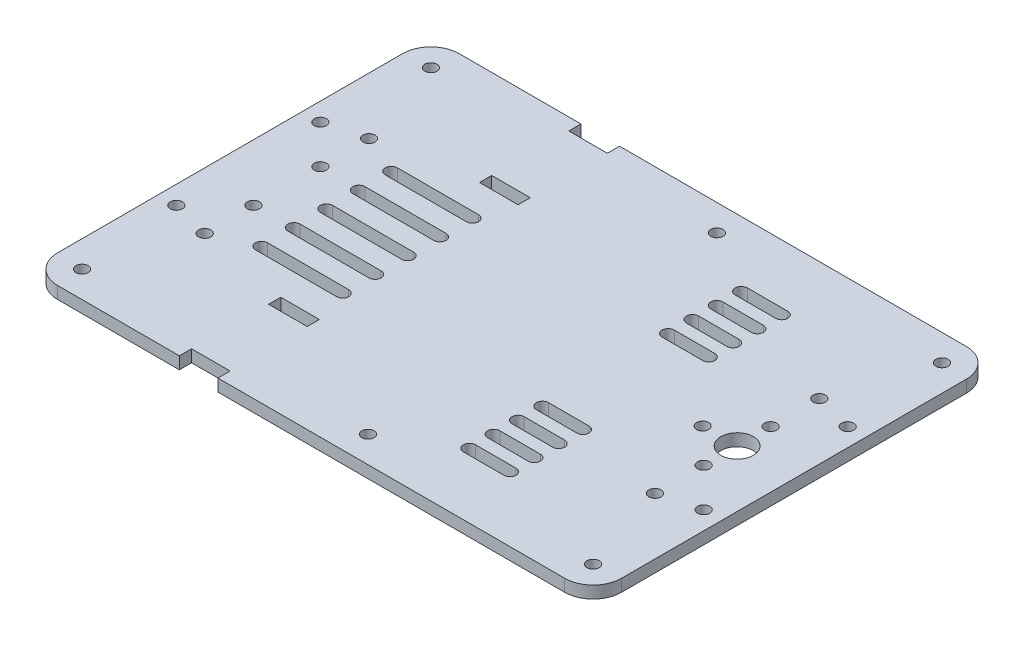
from build123d import *

# Parameters (mm, degrees)
SKETCH1_R           = 1.5
SKETCH1_W           = 9.5
SKETCH1_H           = 3
SKETCH1_R_2         = 4
BOSS_EXTRUDE1_DEPTH = 3


with BuildPart() as part:
    # Sketch1 → Boss-Extrude1 (new body)
    with BuildSketch(Plane(origin=(0, 0, 0), x_dir=(1, 0, 0), z_dir=(0, 1, 0))):
        with BuildLine():
            Line((-23, 46.5), (-32.5, 46.5))
            Line((-32.5, 46.5), (-32.5, 49.5))
            Line((-32.5, 49.5), (-62.5, 49.5))
            ThreePointArc((-62.5, 49.5), (-67.449747468, 47.449747468), (-69.5, 42.5))
            Line((-69.5, 42.5), (-69.5, -42.5))
            ThreePointArc((-69.5, -42.5), (-67.449747468, -47.449747468), (-62.5, -49.5))
            Line((-62.5, -49.5), (-32.5, -49.5))
            Line((-32.5, -49.5), (-32.5, -46.5))
            Line((-32.5, -46.5), (-23, -46.5))
            Line((-23, -46.5), (-23, -49.5))
            Line((-23, -49.5), (62.5, -49.5))
            ThreePointArc((62.5, -49.5), (67.449747468, -47.449747468), (69.5, -42.5))
            Line((69.5, -42.5), (69.5, 42.5))
            ThreePointArc((69.5, 42.5), (67.449747468, 47.449747468), (62.5, 49.5))
            Line((62.5, 49.5), (-23, 49.5))
            Line((-23, 49.5), (-23, 46.5))
        make_face()
        with Locations((-63, -43)):
            Circle(SKETCH1_R, mode=Mode.SUBTRACT)
        with Locations((-27.75, -26)):
            Rectangle(SKETCH1_W, SKETCH1_H, mode=Mode.SUBTRACT)
        with Locations((-55.5, -20.25)):
            Circle(SKETCH1_R, mode=Mode.SUBTRACT)
        with Locations((-65, -17.75)):
            Circle(SKETCH1_R, mode=Mode.SUBTRACT)
        with BuildLine():
            Line((-25.75, -17.5), (-45.75, -17.5))
            ThreePointArc((-45.75, -17.5), (-47.25, -16), (-45.75, -14.5))
            Line((-45.75, -14.5), (-25.75, -14.5))
            ThreePointArc((-25.75, -14.5), (-24.25, -16), (-25.75, -17.5))
        make_face(mode=Mode.SUBTRACT)
        with Locations((-55.5, -8.25)):
            Circle(SKETCH1_R, mode=Mode.SUBTRACT)
        with BuildLine():
            Line((-25.75, -9.5), (-45.75, -9.5))
            ThreePointArc((-45.75, -9.5), (-47.25, -8), (-45.75, -6.5))
            Line((-45.75, -6.5), (-25.75, -6.5))
            ThreePointArc((-25.75, -6.5), (-24.25, -8), (-25.75, -9.5))
        make_face(mode=Mode.SUBTRACT)
        with BuildLine():
            Line((-25.75, -1.5), (-45.75, -1.5))
            ThreePointArc((-45.75, -1.5), (-47.25, 0), (-45.75, 1.5))
            Line((-45.75, 1.5), (-25.75, 1.5))
            ThreePointArc((-25.75, 1.5), (-24.25, 0), (-25.75, -1.5))
        make_face(mode=Mode.SUBTRACT)
        with Locations((7.5, -43)):
            Circle(SKETCH1_R, mode=Mode.SUBTRACT)
        with BuildLine():
            Line((23, -32), (33, -32))
            ThreePointArc((33, -32), (34.5, -33.5), (33, -35))
            Line((33, -35), (23, -35))
            ThreePointArc((23, -35), (21.5, -33.5), (23, -32))
        make_face(mode=Mode.SUBTRACT)
        with BuildLine():
            Line((23, -26), (33, -26))
            ThreePointArc((33, -26), (34.5, -27.5), (33, -29))
            Line((33, -29), (23, -29))
            ThreePointArc((23, -29), (21.5, -27.5), (23, -26))
        make_face(mode=Mode.SUBTRACT)
        with Locations((63, -43)):
            Circle(SKETCH1_R, mode=Mode.SUBTRACT)
        with BuildLine():
            Line((23, -20), (33, -20))
            ThreePointArc((33, -20), (34.5, -21.5), (33, -23))
            Line((33, -23), (23, -23))
            ThreePointArc((23, -23), (21.5, -21.5), (23, -20))
        make_face(mode=Mode.SUBTRACT)
        with BuildLine():
            Line((23, -14), (33, -14))
            ThreePointArc((33, -14), (34.5, -15.5), (33, -17))
            Line((33, -17), (23, -17))
            ThreePointArc((23, -17), (21.5, -15.5), (23, -14))
        make_face(mode=Mode.SUBTRACT)
        with Locations((55.5, -20.25)):
            Circle(SKETCH1_R, mode=Mode.SUBTRACT)
        with Locations((65, -17.75)):
            Circle(SKETCH1_R, mode=Mode.SUBTRACT)
        with Locations((55.5, -8.25)):
            Circle(SKETCH1_R, mode=Mode.SUBTRACT)
        with Locations((-55.5, 8.25)):
            Circle(SKETCH1_R, mode=Mode.SUBTRACT)
        with BuildLine():
            Line((-25.75, 6.5), (-45.75, 6.5))
            ThreePointArc((-45.75, 6.5), (-47.25, 8), (-45.75, 9.5))
            Line((-45.75, 9.5), (-25.75, 9.5))
            ThreePointArc((-25.75, 9.5), (-24.25, 8), (-25.75, 6.5))
        make_face(mode=Mode.SUBTRACT)
        with Locations((-65, 17.75)):
            Circle(SKETCH1_R, mode=Mode.SUBTRACT)
        with Locations((-55.5, 20.25)):
            Circle(SKETCH1_R, mode=Mode.SUBTRACT)
        with BuildLine():
            ThreePointArc((-45.75, 14.5), (-47.25, 16), (-45.75, 17.5))
            Line((-45.75, 17.5), (-25.75, 17.5))
            ThreePointArc((-25.75, 17.5), (-24.25, 16), (-25.75, 14.5))
            Line((-25.75, 14.5), (-45.75, 14.5))
        make_face(mode=Mode.SUBTRACT)
        with Locations((-63, 43)):
            Circle(SKETCH1_R, mode=Mode.SUBTRACT)
        with Locations((-27.75, 26)):
            Rectangle(SKETCH1_W, SKETCH1_H, mode=Mode.SUBTRACT)
        with BuildLine():
            ThreePointArc((33, 17), (34.5, 15.5), (33, 14))
            Line((33, 14), (23, 14))
            ThreePointArc((23, 14), (21.5, 15.5), (23, 17))
            Line((23, 17), (33, 17))
        make_face(mode=Mode.SUBTRACT)
        with BuildLine():
            Line((23, 23), (33, 23))
            ThreePointArc((33, 23), (34.5, 21.5), (33, 20))
            Line((33, 20), (23, 20))
            ThreePointArc((23, 20), (21.5, 21.5), (23, 23))
        make_face(mode=Mode.SUBTRACT)
        with Locations((47, 0)):
            Circle(SKETCH1_R, mode=Mode.SUBTRACT)
        with Locations((55.5, 0)):
            Circle(SKETCH1_R_2, mode=Mode.SUBTRACT)
        with Locations((55.5, 8.25)):
            Circle(SKETCH1_R, mode=Mode.SUBTRACT)
        with Locations((65, 17.75)):
            Circle(SKETCH1_R, mode=Mode.SUBTRACT)
        with Locations((55.5, 20.25)):
            Circle(SKETCH1_R, mode=Mode.SUBTRACT)
        with BuildLine():
            Line((23, 29), (33, 29))
            ThreePointArc((33, 29), (34.5, 27.5), (33, 26))
            Line((33, 26), (23, 26))
            ThreePointArc((23, 26), (21.5, 27.5), (23, 29))
        make_face(mode=Mode.SUBTRACT)
        with BuildLine():
            Line((23, 35), (33, 35))
            ThreePointArc((33, 35), (34.5, 33.5), (33, 32))
            Line((33, 32), (23, 32))
            ThreePointArc((23, 32), (21.5, 33.5), (23, 35))
        make_face(mode=Mode.SUBTRACT)
        with Locations((7.5, 43)):
            Circle(SKETCH1_R, mode=Mode.SUBTRACT)
        with Locations((63, 43)):
            Circle(SKETCH1_R, mode=Mode.SUBTRACT)
    extrude(amount=BOSS_EXTRUDE1_DEPTH)


solid = part.part
